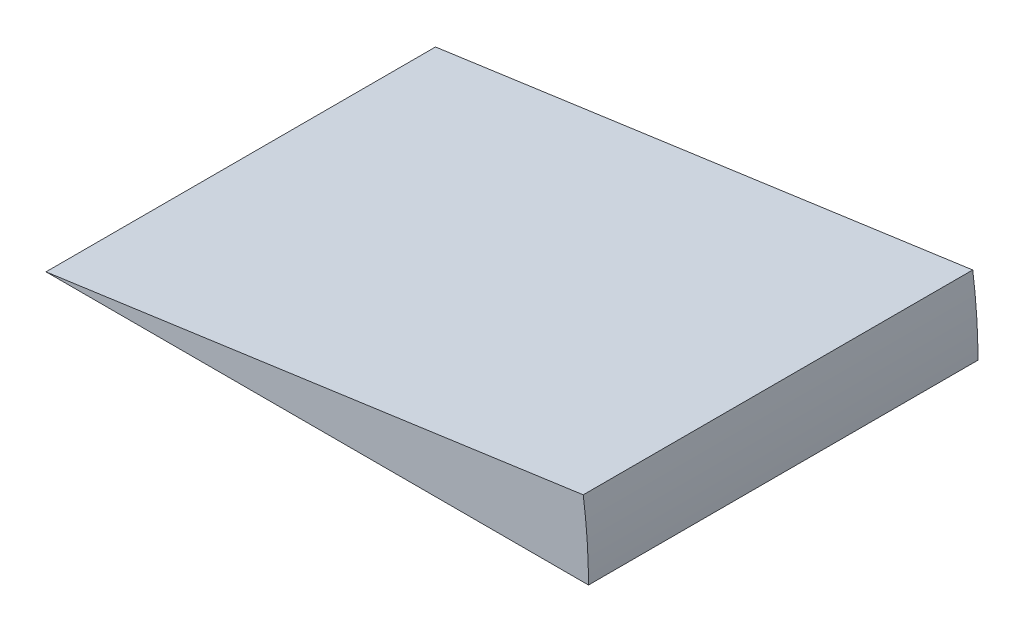
from build123d import *

# Parameters (mm, degrees)
SKETCH1_W      = 108.966
SKETCH1_H      = 78.232
REVOLVE1_ANGLE = 8


with BuildPart() as part:
    # Sketch1 → Revolve1 (revolve)
    with BuildSketch(Plane(origin=(0, 0, 0), x_dir=(1, 0, 0), z_dir=(0, 1, 0))):
        Rectangle(SKETCH1_W, SKETCH1_H)
    revolve(axis=Axis((-54.483, 0, 39.116), (0, 0, 1)), revolution_arc=REVOLVE1_ANGLE)


solid = part.part
